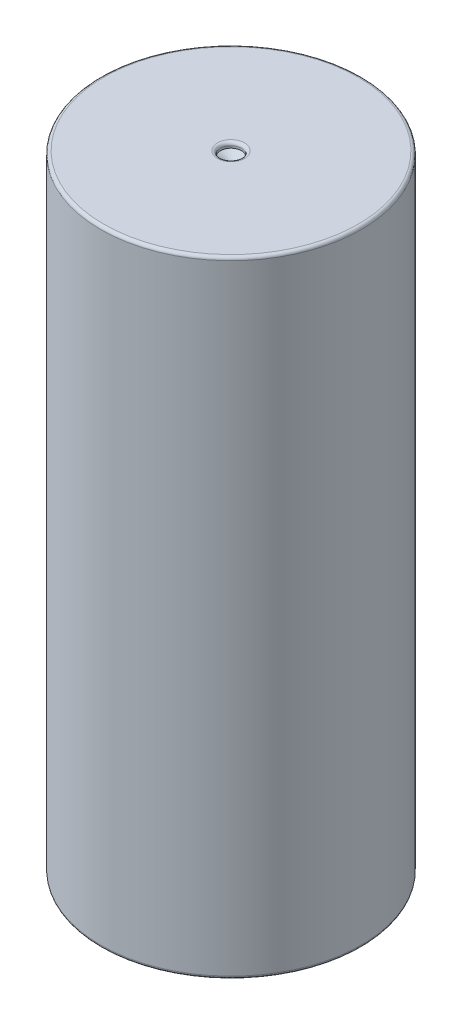
from build123d import *

# Parameters (mm, degrees)
SKETCH2_W = 12.5
SKETCH2_H = 60
FILLET1_R = 0.3


with BuildPart() as part:
    # Sketch2 → Revolve1 (revolve)
    with BuildSketch(Plane.XY):
        with Locations((6.25, 0)):
            Rectangle(SKETCH2_W, SKETCH2_H)
    revolve(axis=Axis((0, 30, 0), (0, -1, 0)))

    # Sketch4 → Cut-Revolve1 (revolve, cut)
    with BuildSketch(Plane.XY):
        Polygon((0, 30), (0, 29), (1, 29.5), (1, 30), align=None)
    cut_revolve1 = revolve(axis=Axis((0, 30, 0), (0, -1, 0)), mode=Mode.SUBTRACT)

    # Mirror2: Cut-Revolve1 across plane
    add(cut_revolve1.mirror(Plane.ZX), mode=Mode.SUBTRACT)

    # Fillet1
    fillet1_edges = [part.edges().sort_by_distance(p)[0] for p in [
        (-12.5, 30, 0),
        (-1, 30, 0),
        (-12.5, -30, 0),
        (-1, -30, 0),
    ]]
    fillet(fillet1_edges, radius=FILLET1_R)


solid = part.part
